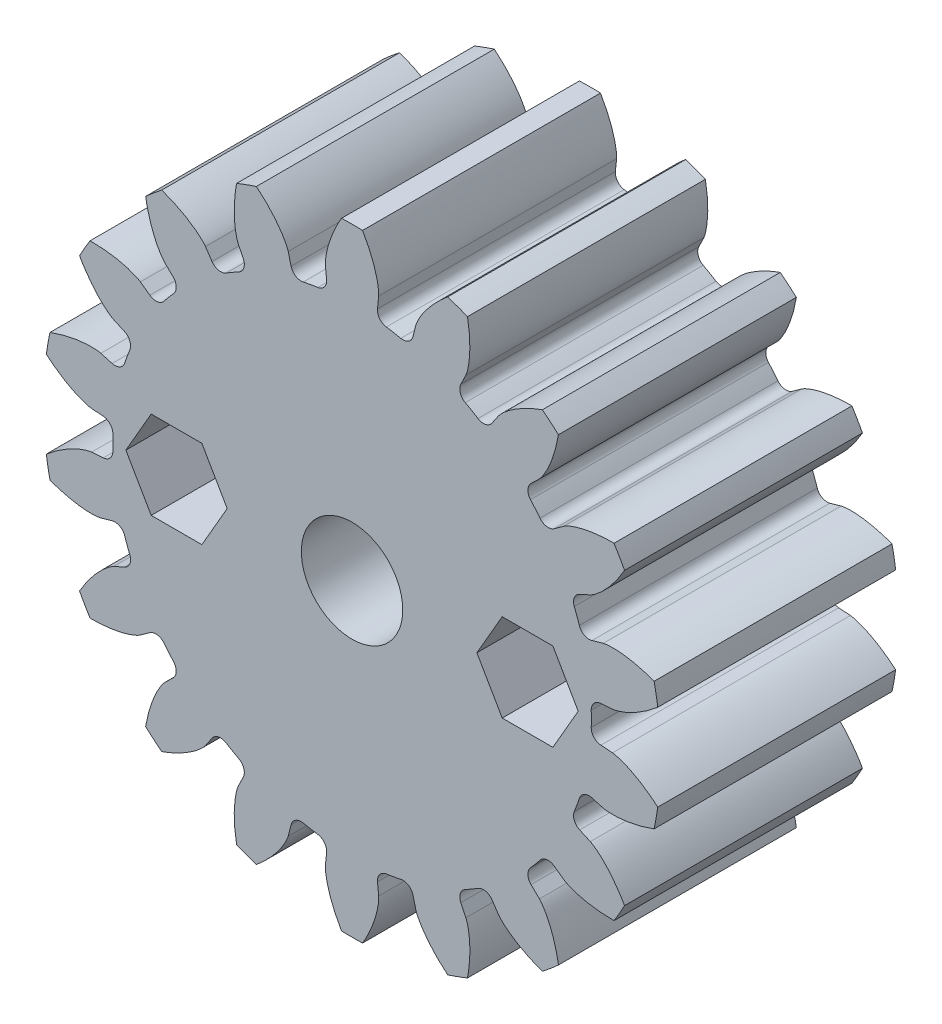
from build123d import *
from OCP.BRepAlgoAPI import BRepAlgoAPI_Cut
from OCP.TopTools import TopTools_ListOfShape

# Parameters (mm, degrees)
SKETCH3_R                = 10.583333333
BOSS_EXTRUDE1_DEPTH      = 10.16
CUT_EXTRUDE1_DEPTH       = 19.089761991
FILLET1_R                = 0.355076163
CIRPATTERN1_COUNT        = 18
FILLET1_OF_CIRPATTERN1_R = 0.355076163
SCALE1_SCALE             = 1.9
SKETCH6_R                = 3.302
CUT_EXTRUDE2_DEPTH       = 10.16
SKETCH12_R               = 21.437549665
CUT_EXTRUDE7_DEPTH       = 3.81
CUT_EXTRUDE8_DEPTH       = 11.43
SKETCH14_R               = 1.651
CUT_EXTRUDE9_DEPTH       = 33.261902172


with BuildPart() as part:
    # Sketch3 → Boss-Extrude1 (new body)
    with BuildSketch(Plane.XY):
        Circle(SKETCH3_R)
    extrude(amount=-BOSS_EXTRUDE1_DEPTH)

    # Sketch4 → Cut-Extrude1 (cut, symmetric)
    with BuildSketch(Plane.XY):
        with BuildLine():
            Line((8.180618539, 0.593001964), (8.927148628, 0.647116919))
            add(Edge.make_bspline(
                [(8.927148628, 0.647116919), (8.929773603, 0.64734246), (8.937126743, 0.648083571), (8.950989701, 0.649913095), (8.97354406, 0.653505718), (9.002174883, 0.658974713), (9.039040294, 0.667064652), (9.08227108, 0.677905244), (9.129552823, 0.691187893), (9.180725702, 0.707111733), (9.231524372, 0.724296782), (9.281946361, 0.742644429), (9.331936661, 0.762005639), (9.392192531, 0.786734306), (9.464019144, 0.81815733), (9.547307729, 0.857451379), (9.640949476, 0.905033405), (9.735448155, 0.956729189), (9.827643658, 1.01022152), (9.919826595, 1.067258688), (10.008328253, 1.124562674), (10.099192996, 1.187113225), (10.182530598, 1.246394384), (10.274659666, 1.316128649), (10.348652098, 1.373376845), (10.424010343, 1.435256389), (10.460526963, 1.465776942), (10.479120716, 1.481544284)],
                knots=[0, 0, 0, 0, 0, 0.005376749, 0.015083688, 0.02853182, 0.04661014, 0.064854849, 0.092110526, 0.119476176, 0.146842496, 0.174208854, 0.201574956, 0.228941013, 0.256307345, 0.307035032, 0.361767352, 0.416499661, 0.471231937, 0.525964282, 0.580696616, 0.635428982, 0.690161387, 0.744893688, 0.799626082, 0.854358407, 0.909090915, 0.909090915, 0.909090915, 0.909090915, 0.909090915], degree=4))
            ThreePointArc((10.479120716, 1.481544284), (10.583333333, 0), (10.479120716, -1.481544284))
            add(Edge.make_bspline(
                [(8.927148628, -0.647116919), (8.929773603, -0.64734246), (8.937126743, -0.648083571), (8.950989701, -0.649913095), (8.97354406, -0.653505718), (9.002174883, -0.658974713), (9.039040294, -0.667064652), (9.08227108, -0.677905244), (9.129552823, -0.691187893), (9.180725702, -0.707111733), (9.231524372, -0.724296782), (9.281946361, -0.742644429), (9.331936661, -0.762005639), (9.392192531, -0.786734306), (9.464019144, -0.81815733), (9.547307729, -0.857451379), (9.640949476, -0.905033405), (9.735448155, -0.956729189), (9.827643658, -1.01022152), (9.919826595, -1.067258688), (10.008328253, -1.124562674), (10.099192996, -1.187113225), (10.182530598, -1.246394384), (10.274659666, -1.316128649), (10.348652098, -1.373376845), (10.424010343, -1.435256389), (10.460526963, -1.465776942), (10.479120716, -1.481544284)],
                knots=[0, 0, 0, 0, 0, 0.005376749, 0.015083688, 0.02853182, 0.04661014, 0.064854849, 0.092110526, 0.119476176, 0.146842496, 0.174208854, 0.201574956, 0.228941013, 0.256307345, 0.307035032, 0.361767352, 0.416499661, 0.471231937, 0.525964282, 0.580696616, 0.635428982, 0.690161387, 0.744893688, 0.799626082, 0.854358407, 0.909090915, 0.909090915, 0.909090915, 0.909090915, 0.909090915], degree=4))
            Line((8.927148628, -0.647116919), (8.180618539, -0.593001964))
            ThreePointArc((8.180618539, -0.593001964), (8.202083333, 0), (8.180618539, 0.593001964))
        make_face()
    cut_extrude1 = extrude(amount=CUT_EXTRUDE1_DEPTH, both=True, mode=Mode.SUBTRACT)

    # Fillet1
    fillet1_edges = [part.edges().sort_by_distance(p)[0] for p in [
        (8.180618539, -0.593001964, -5.08),
        (8.180618539, 0.593001964, -5.08),
    ]]
    fillet(fillet1_edges, radius=FILLET1_R)

    # CirPattern1: Cut-Extrude1 ×18 about axis
    cirpattern1_axis = Axis((0, 0, 6.35), (0, 0, -1))
    for i in range(1, CIRPATTERN1_COUNT):
        add(cut_extrude1.rotate(cirpattern1_axis, i * 360 / CIRPATTERN1_COUNT), mode=Mode.SUBTRACT)

    # Fillet1 of CirPattern1
    fillet1_of_cirpattern1_edges = [part.edges().sort_by_distance(p)[0] for p in [
        (7.484448258, -3.355175895, -5.08),
        (7.890085491, -2.240696756, -5.08),
        (5.885543058, -5.712666095, -5.08),
        (6.647891688, -4.804134377, -5.08),
        (3.576754504, -7.381124455, -5.08),
        (4.603864035, -6.788122491, -5.08),
        (0.83655657, -8.159310272, -5.08),
        (2.004542433, -7.953362851, -5.08),
        (-2.004542433, -7.953362851, -5.08),
        (-0.83655657, -8.159310272, -5.08),
        (-4.603864035, -6.788122491, -5.08),
        (-3.576754504, -7.381124455, -5.08),
        (-6.647891688, -4.804134377, -5.08),
        (-5.885543058, -5.712666095, -5.08),
        (-7.890085491, -2.240696756, -5.08),
        (-7.484448258, -3.355175895, -5.08),
        (-8.180618539, 0.593001964, -5.08),
        (-8.180618539, -0.593001964, -5.08),
        (-7.484448258, 3.355175895, -5.08),
        (-7.890085491, 2.240696756, -5.08),
        (-5.885543058, 5.712666095, -5.08),
        (-6.647891688, 4.804134377, -5.08),
        (-3.576754504, 7.381124455, -5.08),
        (-4.603864035, 6.788122491, -5.08),
        (-0.83655657, 8.159310272, -5.08),
        (-2.004542433, 7.953362851, -5.08),
        (2.004542433, 7.953362851, -5.08),
        (0.83655657, 8.159310272, -5.08),
        (4.603864035, 6.788122491, -5.08),
        (3.576754504, 7.381124455, -5.08),
        (6.647891688, 4.804134377, -5.08),
        (5.885543058, 5.712666095, -5.08),
        (7.890085491, 2.240696756, -5.08),
        (7.484448258, 3.355175895, -5.08),
    ]]
    fillet(fillet1_of_cirpattern1_edges, radius=FILLET1_OF_CIRPATTERN1_R)


with BuildPart() as part_1:
    # Scale1: scaled about (0, 0, -5.079999529)
    add(part.part.scale(SCALE1_SCALE).moved(Location((0, 0, 4.571999576))))


with BuildPart() as cut_extrude2_tool:
    # Sketch6 → Cut-Extrude2 (new body)
    with BuildSketch(Plane.XY.offset(4.571998152)):
        Circle(SKETCH6_R)
    extrude(amount=-CUT_EXTRUDE2_DEPTH)


with BuildPart() as part_2:
    add(part_1.part)

    # Cut-Extrude2: cut by cut_extrude2_tool, with a tolerance
    cut_extrude2_stock = TopTools_ListOfShape()
    cut_extrude2_stock.Append(part_2.part.wrapped)
    cut_extrude2_tools = TopTools_ListOfShape()
    cut_extrude2_tools.Append(cut_extrude2_tool.part.wrapped)
    cut_extrude2_cut = BRepAlgoAPI_Cut()
    cut_extrude2_cut.SetArguments(cut_extrude2_stock)
    cut_extrude2_cut.SetTools(cut_extrude2_tools)
    cut_extrude2_cut.SetFuzzyValue(0.00001)
    cut_extrude2_cut.Build()
    add(Compound.cast(cut_extrude2_cut.Shape()).solids(), mode=Mode.REPLACE)

    # Sketch12 → Cut-Extrude7 (cut)
    with BuildSketch(Plane(origin=(0, 0, -14.732001848), x_dir=(-1, 0, 0), z_dir=(0, 0, -1))):
        Circle(SKETCH12_R)
    extrude(amount=-CUT_EXTRUDE7_DEPTH, mode=Mode.SUBTRACT)


with BuildPart() as cut_extrude8_tool:
    # Sketch13 → Cut-Extrude8 (new body)
    with BuildSketch(Plane.XY.offset(4.571998152)):
        Polygon((-8.130443212, 0), (-9.780221606, 2.8575), (-13.079778394, 2.8575), (-14.729556788, 0), (-13.079778394, -2.8575), (-9.780221606, -2.8575), align=None)
        Polygon((14.729556788, 0), (13.079778394, 2.8575), (9.780221606, 2.8575), (8.130443212, 0), (9.780221606, -2.8575), (13.079778394, -2.8575), align=None)
    extrude(amount=-CUT_EXTRUDE8_DEPTH)


with BuildPart() as part_3:
    add(part_2.part)

    # Cut-Extrude8: cut by cut_extrude8_tool, with a tolerance
    cut_extrude8_stock = TopTools_ListOfShape()
    cut_extrude8_stock.Append(part_3.part.wrapped)
    cut_extrude8_tools = TopTools_ListOfShape()
    cut_extrude8_tools.Append(cut_extrude8_tool.part.wrapped)
    cut_extrude8_cut = BRepAlgoAPI_Cut()
    cut_extrude8_cut.SetArguments(cut_extrude8_stock)
    cut_extrude8_cut.SetTools(cut_extrude8_tools)
    cut_extrude8_cut.SetFuzzyValue(0.00001)
    cut_extrude8_cut.Build()
    add(Compound.cast(cut_extrude8_cut.Shape()).solids(), mode=Mode.REPLACE)

    # Sketch14 → Cut-Extrude9 (cut, through all)
    with BuildSketch(Plane.XY.offset(4.571998152)):
        with Locations((-11.43, 0)):
            Circle(SKETCH14_R)
        with Locations((11.43, 0)):
            Circle(SKETCH14_R)
    extrude(amount=-CUT_EXTRUDE9_DEPTH, mode=Mode.SUBTRACT)


solid = part_3.part
